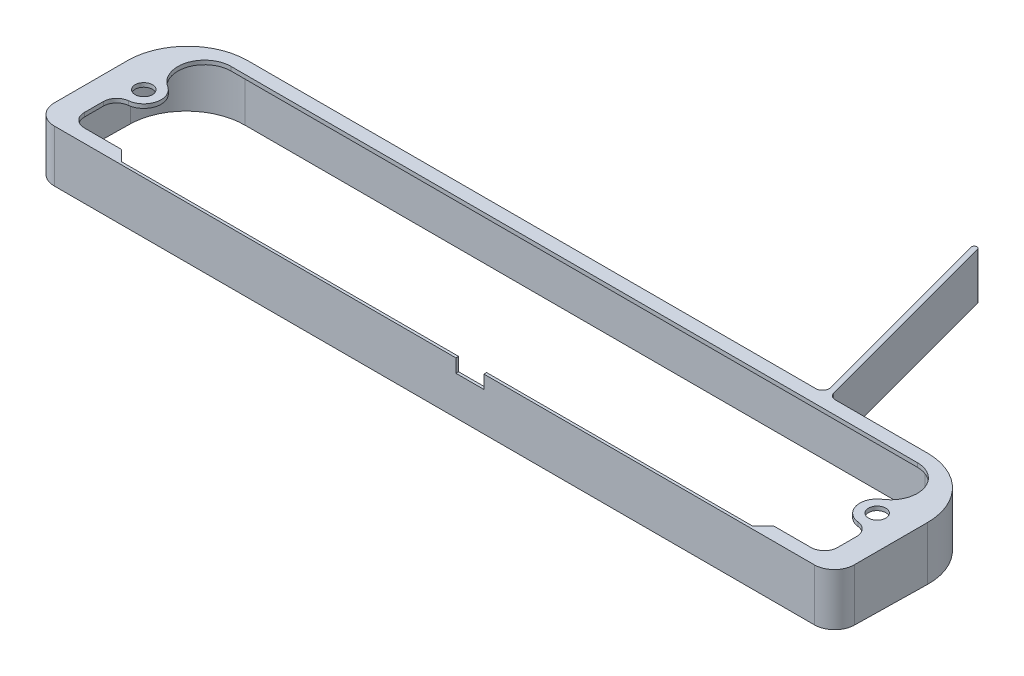
from build123d import *
from build123d.topology import SkipClean

# Parameters (mm, degrees)
SKETCH1_R               = 1.3
BOSS_EXTRUDE1_DEPTH     = 0.6
BOSS_EXTRUDE2_START     = 7.6
BOSS_EXTRUDE2_DEPTH     = 8.2
CHAMFER1_SIZE           = 0.6
CUT_EXTRUDE1_DEPTH      = 65.705177536
CUT_EXTRUDE1_DEPTH_BACK = 65.705177536
CUT_EXTRUDE2_REACH      = 66.705
SKETCH11_W              = 4.2
SKETCH11_H              = 2
FILLET1_R               = 2
CHAMFER2_SIZE           = 1.7
BOSS_EXTRUDE3_START     = 0.6
BOSS_EXTRUDE3_DEPTH     = 7
FILLET2_R               = 1


with BuildPart() as part:
    # Sketch1 → Boss-Extrude1 (new body)
    with BuildSketch(Plane(origin=(0, 0, 0), x_dir=(1, 0, 0), z_dir=(0, 1, 0))):
        with BuildLine():
            Line((-57, 0), (-56.5, 0))
            Line((-56.5, 0), (56.5, 0))
            Line((56.5, 0), (57, 0))
            ThreePointArc((57, 0), (59.121320344, 0.878679656), (60, 3))
            Line((60, 3), (60, 14))
            ThreePointArc((60, 14), (57.363961031, 20.363961031), (51, 23))
            Line((51, 23), (-51, 23))
            ThreePointArc((-51, 23), (-57.363961031, 20.363961031), (-60, 14))
            Line((-60, 14), (-60, 3))
            ThreePointArc((-60, 3), (-59.121320344, 0.878679656), (-57, 0))
        make_face()
        with Locations(Location((55, 11.43, 0), (0, 0, 270))):
            Circle(SKETCH1_R, mode=Mode.SUBTRACT)
        with Locations(Location((-55, 11.43, 0), (0, 0, 270))):
            Circle(SKETCH1_R, mode=Mode.SUBTRACT)
        with BuildLine():
            Line((-51.459505684, 21), (51.459505684, 21))
            ThreePointArc((51.459505684, 21), (55.300275809, 18.117356187), (53.605259815, 13.624242424))
            ThreePointArc((53.605259815, 13.624242424), (52.467669637, 10.840675867), (54.717391304, 8.845404804))
            ThreePointArc((54.717391304, 8.845404804), (55.989090764, 8.192398352), (56.5, 6.857254654))
            Line((56.5, 6.857254654), (56.5, 2))
            Line((56.5, 2), (49, 2))
            Line((49, 2), (49, 0.4))
            Line((49, 0.4), (-49, 0.4))
            Line((-49, 0.4), (-49, 2))
            Line((-49, 2), (-56.5, 2))
            Line((-56.5, 2), (-56.5, 6.857254654))
            ThreePointArc((-56.5, 6.857254654), (-55.989090764, 8.192398352), (-54.717391304, 8.845404804))
            ThreePointArc((-54.717391304, 8.845404804), (-52.467669637, 10.840675867), (-53.605259815, 13.624242424))
            ThreePointArc((-53.605259815, 13.624242424), (-55.300275809, 18.117356187), (-51.459505684, 21))
        make_face(mode=Mode.SUBTRACT)
    extrude(amount=BOSS_EXTRUDE1_DEPTH)

    # Sketch8 → Boss-Extrude2 (add)
    with SkipClean():  # the faces are left unmerged after this step: merging them gives an invalid solid
        with BuildSketch(Plane(origin=(0, 0, 0), x_dir=(-1, 0, 0), z_dir=(0, -1, 0)).offset(BOSS_EXTRUDE2_START)):
            with BuildLine():
                Line((-57, 0), (57, 0))
                ThreePointArc((57, 0), (59.121320344, 0.878679656), (60, 3))
                Line((60, 3), (60, 14))
                ThreePointArc((60, 14), (57.363961031, 20.363961031), (51, 23))
                Line((51, 23), (-51, 23))
                ThreePointArc((-51, 23), (-57.363961031, 20.363961031), (-60, 14))
                Line((-60, 14), (-60, 3))
                ThreePointArc((-60, 3), (-59.121320344, 0.878679656), (-57, 0))
            make_face()
            with BuildLine():
                Line((51, 22.6), (-51, 22.6))
                ThreePointArc((-51, 22.6), (-57.081118318, 20.081118318), (-59.6, 14))
                Line((-59.6, 14), (-59.6, 3))
                ThreePointArc((-59.6, 3), (-58.838477631, 1.161522369), (-57, 0.4))
                Line((-57, 0.4), (57, 0.4))
                ThreePointArc((57, 0.4), (58.838477631, 1.161522369), (59.6, 3))
                Line((59.6, 3), (59.6, 14))
                ThreePointArc((59.6, 14), (57.081118318, 20.081118318), (51, 22.6))
            make_face(mode=Mode.SUBTRACT)
        extrude(amount=-BOSS_EXTRUDE2_DEPTH)
    add(part.part.scale(1), mode=Mode.REPLACE)  # the faces are merged on a copy

    # Chamfer1
    chamfer1_edges = [part.edges().sort_by_distance(p)[0] for p in [
        (-53, 0, -0.4),
        (53, 0, -0.4),
        (-58.838477631, 0, -1.161522369),
        (-59.6, 0, -8.5),
        (-57.081118318, 0, -20.081118318),
        (0, 0, -22.6),
        (57.081118318, 0, -20.081118318),
        (59.6, 0, -8.5),
        (58.838477631, 0, -1.161522369),
    ]]
    chamfer(chamfer1_edges, length=CHAMFER1_SIZE)

    # Sketch9 → Cut-Extrude1 (cut, two sides: drawn at the far end of the back side and taken through both)
    with BuildSketch(Plane(origin=(0, 0, 0), x_dir=(0, 0, -1), z_dir=(1, 0, 0)).offset(-CUT_EXTRUDE1_DEPTH_BACK)):
        Polygon((-2, -7.6), (23, -7.6), (-2, -7.163623377), align=None)
    extrude(amount=CUT_EXTRUDE1_DEPTH + CUT_EXTRUDE1_DEPTH_BACK, mode=Mode.SUBTRACT)

    # Sketch11 → Cut-Extrude2 (cut, up to next)
    with BuildSketch(Plane.XY, mode=Mode.PRIVATE) as cut_extrude2_sk1:
        with Locations((5.35, -0.4)):
            Rectangle(SKETCH11_W, SKETCH11_H)
    cut_extrude2_tool1 = extrude(cut_extrude2_sk1.sketch, amount=-CUT_EXTRUDE2_REACH, mode=Mode.PRIVATE) & part.part
    add(cut_extrude2_tool1.solids().sort_by_distance((5.35, -0.4, 0))[0], mode=Mode.SUBTRACT)

    # Fillet1
    fillet1_edges = [part.edges().sort_by_distance(p)[0] for p in [
        (-56.5, 0.3, -2),
        (56.5, 0.3, -2),
    ]]
    fillet(fillet1_edges, radius=FILLET1_R)

    # Chamfer2
    # the kernel refuses this chamfer: 1.7 mm, written as the material it adds along each edge
    with BuildSketch(Plane(origin=(-49, -4.97186108, -0.4), x_dir=(-0.02749587661058786, 0, -0.9996219169112968), z_dir=(0, 1, 0))) as chamfer2_piece_1_section:
        Polygon((CHAMFER2_SIZE * 0.999621916911, -CHAMFER2_SIZE * 0.0274958766106), (-CHAMFER2_SIZE * 0.0274958766106, -CHAMFER2_SIZE * 0.999621916911), (0, 0), align=None)
    chamfer2_piece_1 = extrude(amount=5.57186108, mode=Mode.PRIVATE)
    chamfer2_piece_1 = split(chamfer2_piece_1, bisect_by=Plane(origin=(-48.243333333, -0.31, -0.69), z_dir=(0, 0.7071067811865475, 0.7071067811865476)), keep=Keep.TOP, mode=Mode.PRIVATE)
    add(chamfer2_piece_1)
    with BuildSketch(Plane(origin=(-49, -4.97186108, -0.4), x_dir=(-0.02749587661058786, 0, -0.9996219169112968), z_dir=(0, 1, 0))) as chamfer2_piece_2_section:
        Polygon((CHAMFER2_SIZE * 0.999621916911, -CHAMFER2_SIZE * 0.0274958766106), (-CHAMFER2_SIZE * 0.0274958766106, -CHAMFER2_SIZE * 0.999621916911), (0, 0), align=None)
    chamfer2_piece_2 = extrude(amount=5.57186108, mode=Mode.PRIVATE)
    chamfer2_piece_2 = split(chamfer2_piece_2, bisect_by=Plane(origin=(-48.705555556, 0, -1.511111111), z_dir=(0, 1, 0)), keep=Keep.TOP, mode=Mode.PRIVATE)
    chamfer2_piece_2 = split(chamfer2_piece_2, bisect_by=Plane(origin=(-48.705555556, 0.227272727, -2), z_dir=(0, 0, 1)), keep=Keep.TOP, mode=Mode.PRIVATE)
    add(chamfer2_piece_2)
    with BuildSketch(Plane(origin=(49, 0.6, -0.4), x_dir=(0.02749587661058786, 0, -0.9996219169112968), z_dir=(0, -1, 0))) as chamfer2_piece_3_section:
        Polygon((CHAMFER2_SIZE * 0.999621916911, -CHAMFER2_SIZE * 0.0274958766106), (-CHAMFER2_SIZE * 0.0274958766106, -CHAMFER2_SIZE * 0.999621916911), (0, 0), align=None)
    chamfer2_piece_3 = extrude(amount=5.57186108, mode=Mode.PRIVATE)
    chamfer2_piece_3 = split(chamfer2_piece_3, bisect_by=Plane(origin=(48.35, 0.060810811, -1.060810811), z_dir=(0, 0.7071067811865475, 0.7071067811865476)), keep=Keep.TOP, mode=Mode.PRIVATE)
    add(chamfer2_piece_3)
    with BuildSketch(Plane(origin=(49, 0.6, -0.4), x_dir=(0.02749587661058786, 0, -0.9996219169112968), z_dir=(0, -1, 0))) as chamfer2_piece_4_section:
        Polygon((CHAMFER2_SIZE * 0.999621916911, -CHAMFER2_SIZE * 0.0274958766106), (-CHAMFER2_SIZE * 0.0274958766106, -CHAMFER2_SIZE * 0.999621916911), (0, 0), align=None)
    chamfer2_piece_4 = extrude(amount=5.57186108, mode=Mode.PRIVATE)
    chamfer2_piece_4 = split(chamfer2_piece_4, bisect_by=Plane(origin=(48.705555556, 0, -1.511111111), z_dir=(0, 1, 0)), keep=Keep.TOP, mode=Mode.PRIVATE)
    chamfer2_piece_4 = split(chamfer2_piece_4, bisect_by=Plane(origin=(48.705555556, 0.227272727, -2), z_dir=(0, 0, 1)), keep=Keep.TOP, mode=Mode.PRIVATE)
    add(chamfer2_piece_4)

    # Sketch12 → Boss-Extrude3 (add)
    with BuildSketch(Plane(origin=(0, 0, 0), x_dir=(1, 0, 0), z_dir=(0, 1, 0)).offset(BOSS_EXTRUDE3_START)):
        with BuildLine():
            Line((28.272740661, 53.207055236), (36.366696717, 23))
            Line((36.366696717, 23), (35.538475773, 23))
            Line((35.538475773, 23), (27.5, 53))
            ThreePointArc((27.5, 53), (27.782842712, 53.489897949), (28.272740661, 53.207055236))
        make_face()
    extrude(amount=-BOSS_EXTRUDE3_DEPTH)

    # Fillet2
    fillet2_edges = [part.edges().sort_by_distance(p)[0] for p in [
        (36.366696717, -2.9, -23),
        (35.538475773, -2.9, -23),
    ]]
    fillet(fillet2_edges, radius=FILLET2_R)


solid = part.part
